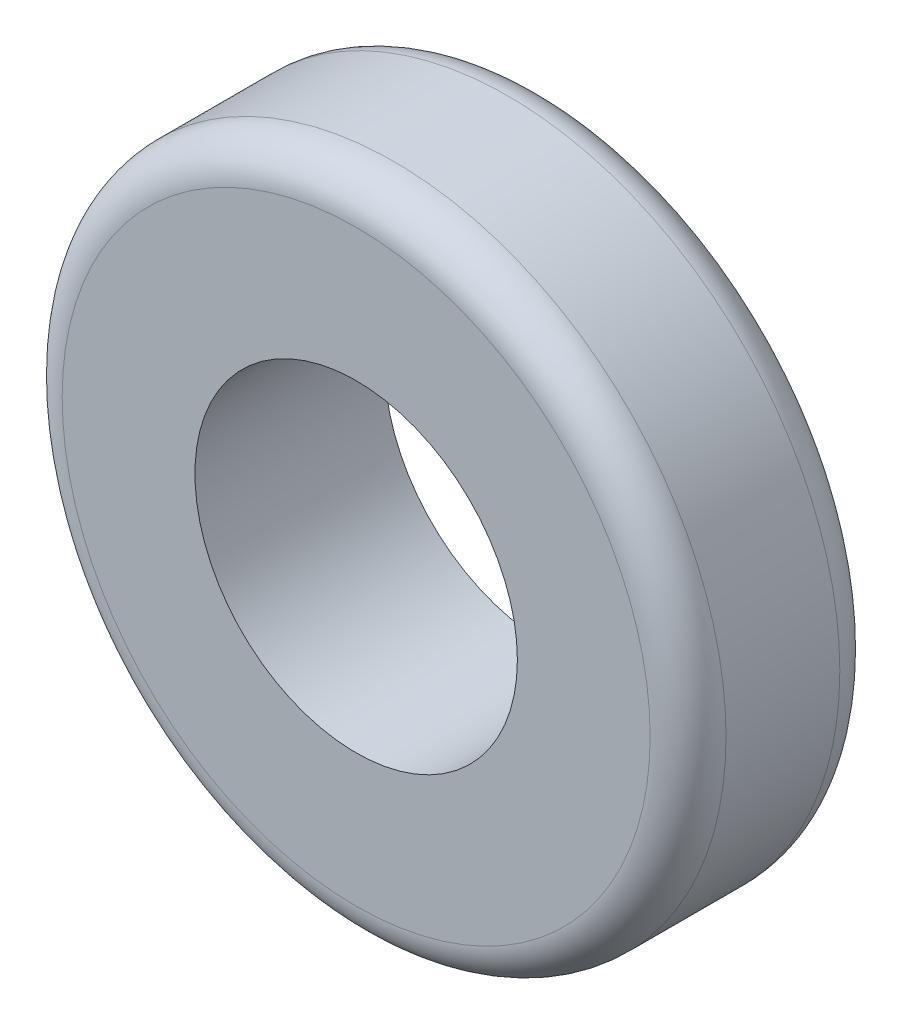
from build123d import *

# Parameters (mm, degrees)
SKETCH1_R           = 17.5
SKETCH1_R_2         = 8.5
BOSS_EXTRUDE1_DEPTH = 10
FILLET1_R           = 2


with BuildPart() as part:
    # Sketch1 → Boss-Extrude1 (new body)
    with BuildSketch(Plane.XY):
        Circle(SKETCH1_R)
        Circle(SKETCH1_R_2, mode=Mode.SUBTRACT)
    extrude(amount=BOSS_EXTRUDE1_DEPTH)

    # Fillet1
    fillet1_edges = [part.edges().sort_by_distance(p)[0] for p in [
        (-17.5, 0, 0),
        (-17.5, 0, 10),
    ]]
    fillet(fillet1_edges, radius=FILLET1_R)


solid = part.part
